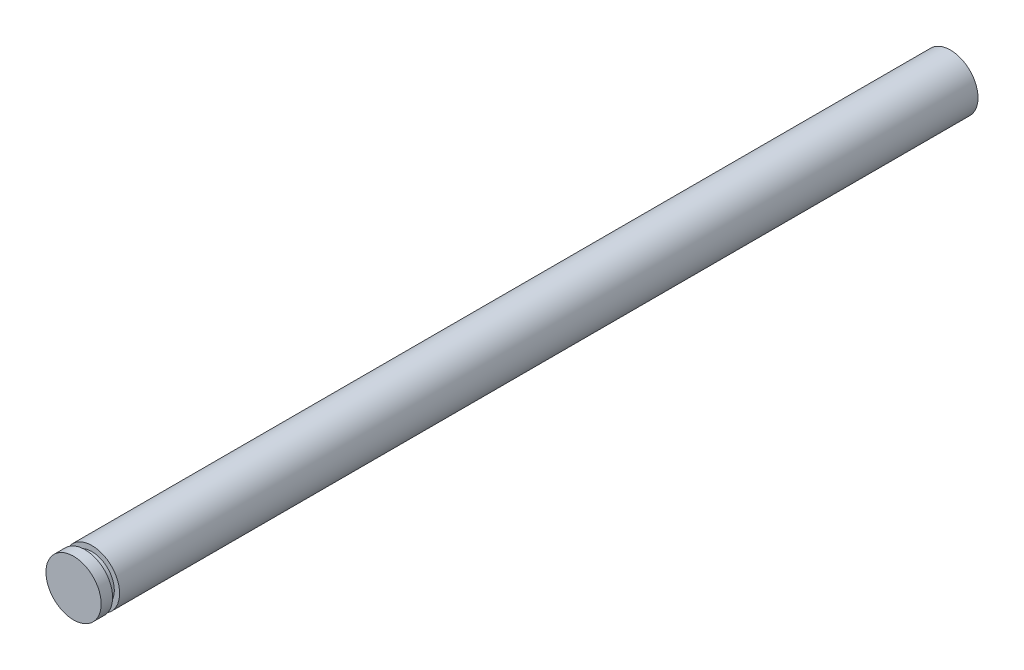
from build123d import *

# Parameters (mm, degrees)
SKETCH1_R           = 2
BOSS_EXTRUDE1_DEPTH = 31.75
SKETCH2_W           = 0.508
SKETCH2_H           = 0.381


with BuildPart() as part:
    # Sketch1 → Boss-Extrude1 (new, symmetric)
    with BuildSketch(Plane.XY):
        Circle(SKETCH1_R)
    extrude(amount=BOSS_EXTRUDE1_DEPTH, both=True)

    # Sketch2 → Cut-Revolve1 (revolve, cut)
    with BuildSketch(Plane(origin=(0, 0, 0), x_dir=(0, 0, -1), z_dir=(1, 0, 0))):
        with Locations((-30.6705, 1.8095)):
            Rectangle(SKETCH2_W, SKETCH2_H)
    revolve(axis=Axis((0, 0, 31.75), (0, 0, -1)), mode=Mode.SUBTRACT)


solid = part.part
